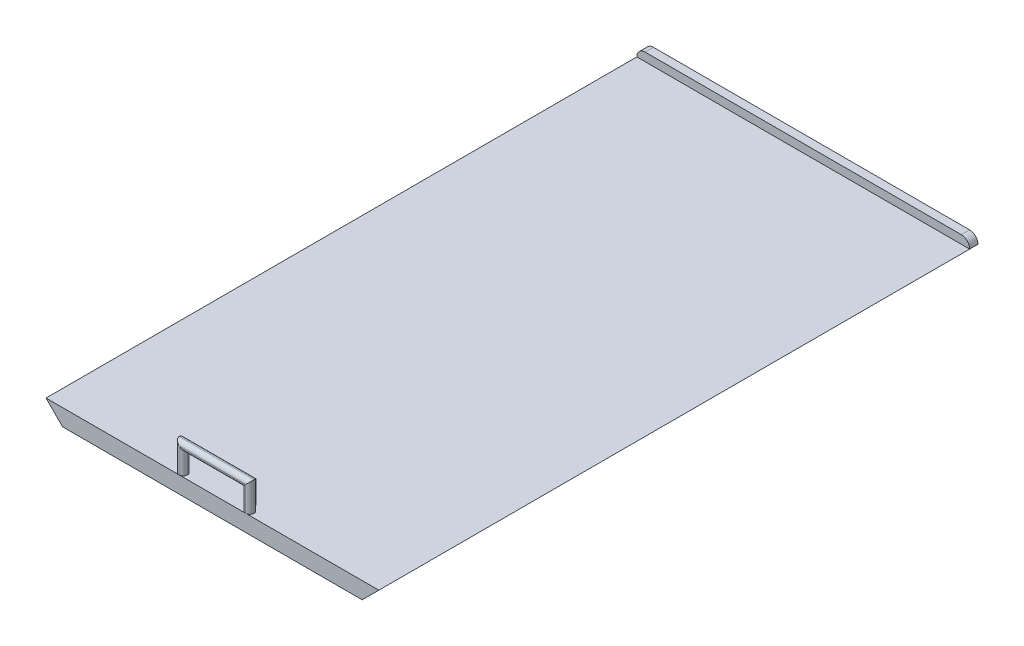
from build123d import *

# Parameters (mm, degrees)
BOSS_EXTRUDE7_DEPTH = 72
SKETCH9_W           = 40
SKETCH9_H           = 1
BOSS_EXTRUDE8_DEPTH = 1
FILLET2_R           = 1
BOSS_EXTRUDE9_START = 71
BOSS_EXTRUDE9_DEPTH = 1
FILLET3_R           = 0.5


with BuildPart() as part:
    # Sketch8 → Boss-Extrude7 (new body)
    with BuildSketch(Plane.XY):
        Polygon((0, 0), (40, 0), (38, -2), (2, -2), align=None)
    extrude(amount=BOSS_EXTRUDE7_DEPTH)

    # Sketch11 → Boss-Extrude9 (add)
    with BuildSketch(Plane.XY.offset(BOSS_EXTRUDE9_START)):
        Polygon((24.5, 3.5), (15.5, 3.5), (15.5, 0), (16.5, 0), (16.5, 2.5), (23.5, 2.5), (23.5, 0), (24.5, 0), align=None)
    extrude(amount=BOSS_EXTRUDE9_DEPTH)

    # Fillet3
    fillet3_edges = [part.edges().sort_by_distance(p)[0] for p in [
        (16.5, 1.25, 71),
        (24.5, 1.75, 71),
        (16.5, 1.25, 72),
        (20, 2.5, 72),
        (20, 3.5, 71),
        (20, 3.5, 72),
        (23.5, 1.25, 71),
        (23.5, 1.25, 72),
        (24.5, 1.75, 72),
        (15.5, 1.75, 71),
        (15.5, 1.75, 72),
    ]]
    fillet(fillet3_edges, radius=FILLET3_R - 0.0001)  # a hair under: the kernel refuses the full size


with BuildPart() as body_2:
    # Sketch9 → Boss-Extrude8 (new body)
    with BuildSketch(Plane(origin=(0, 0, 0), x_dir=(-1, 0, 0), z_dir=(0, 0, -1))):
        with Locations((-20, 0.5)):
            Rectangle(SKETCH9_W, SKETCH9_H)
    extrude(amount=-BOSS_EXTRUDE8_DEPTH)

    # Fillet2
    fillet2_edges = [body_2.edges().sort_by_distance(p)[0] for p in [
        (0, 1, 0.5),
        (40, 1, 0.5),
    ]]
    fillet(fillet2_edges, radius=FILLET2_R - 0.0001)  # a hair under: the kernel refuses the full size


solid = Compound([part.part, body_2.part])
